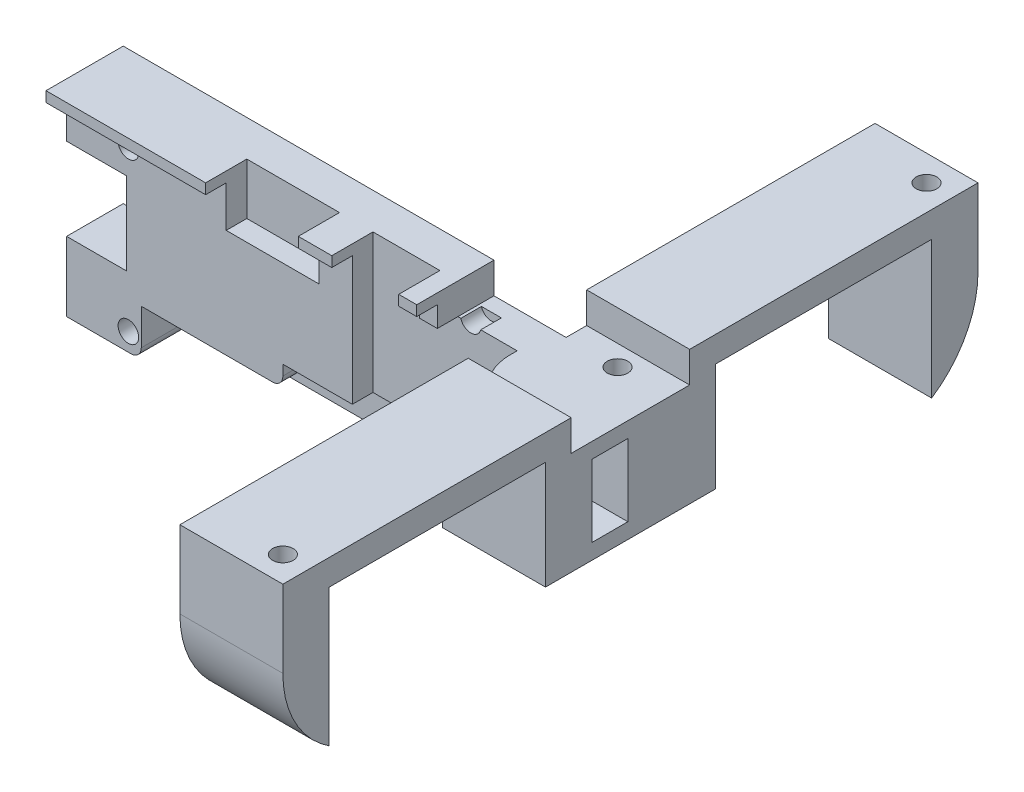
from build123d import *

# Parameters (mm, degrees)
BOSS_EXTRUDE1_DEPTH = 35
CUT_EXTRUDE1_REACH  = 164.604
SKETCH2_W           = 42
SKETCH2_H           = 21
SKETCH3_R           = 2
CUT_EXTRUDE2_DEPTH  = 10
FILLET1_R           = 20
CUT_EXTRUDE5_REACH  = 164.604
SKETCH6_W           = 42
SKETCH6_H           = 9
SKETCH7_R           = 2
CUT_EXTRUDE6_DEPTH  = 12
CUT_EXTRUDE7_DEPTH  = 9
SKETCH9_R           = 2
CUT_EXTRUDE8_DEPTH  = 10
CUT_EXTRUDE9_DEPTH  = 6
SKETCH11_R          = 2
CUT_EXTRUDE10_DEPTH = 9
SKETCH12_R          = 2
CUT_EXTRUDE11_DEPTH = 10
SKETCH14_W          = 83
SKETCH14_H          = 33
CUT_EXTRUDE13_DEPTH = 4
CUT_EXTRUDE14_DEPTH = 6.5
SKETCH16_W          = 14.5
SKETCH16_H          = 11
BOSS_EXTRUDE2_DEPTH = 5
SKETCH13_R          = 2
CUT_EXTRUDE12_DEPTH = 12
FILLET2_R           = 2
FILLET3_R           = 2
SKETCH17_W          = 18
SKETCH17_H          = 10
CUT_EXTRUDE15_DEPTH = 8
CUT_EXTRUDE18_REACH = 104.86
SKETCH20_W          = 8
SKETCH20_H          = 16
CHAMFER1_SIZE       = 10
CHAMFER1_SIZE2      = 3.639702343
CUT_EXTRUDE19_REACH = 164.604
SKETCH22_W          = 7
SKETCH22_H          = 14
FILLET8_R           = 10


with BuildPart() as part:
    # Sketch1 → Boss-Extrude1 (new body)
    with BuildSketch(Plane(origin=(0, 0, 0), x_dir=(1, 0, 0), z_dir=(0, 1, 0))):
        Polygon((-40.317617866, 43.23325062), (45.682382134, 43.23325062), (45.682382134, -16.76674938), (65.682382134, -16.76674938), (65.682382134, 118.23325062), (45.682382134, 118.23325062), (45.682382134, 58.23325062), (-40.317617866, 58.23325062), align=None)
    extrude(amount=BOSS_EXTRUDE1_DEPTH)

    # Sketch2 → Cut-Extrude1 (cut, up to next)
    with BuildSketch(Plane(origin=(65.682382134, 0, 0), x_dir=(0, 0, -1), z_dir=(1, 0, 0)), mode=Mode.PRIVATE) as cut_extrude1_sk1:
        with Locations((13.23325062, 19.5)):
            Rectangle(SKETCH2_W, SKETCH2_H)
    cut_extrude1_tool1 = extrude(cut_extrude1_sk1.sketch, amount=-CUT_EXTRUDE1_REACH, mode=Mode.PRIVATE) & part.part
    # Sketch2 → Cut-Extrude1 (cut, up to next)
    with BuildSketch(Plane(origin=(65.682382134, 0, 0), x_dir=(0, 0, -1), z_dir=(1, 0, 0)), mode=Mode.PRIVATE) as cut_extrude1_sk2:
        with Locations((88.23325062, 19.5)):
            Rectangle(SKETCH2_W, SKETCH2_H)
    cut_extrude1_tool2 = extrude(cut_extrude1_sk2.sketch, amount=-CUT_EXTRUDE1_REACH, mode=Mode.PRIVATE) & part.part
    add(cut_extrude1_tool1.solids().sort_by_distance((65.682382, 19.5, -13.233251))[0], mode=Mode.SUBTRACT)
    add(cut_extrude1_tool2.solids().sort_by_distance((65.682382, 19.5, -88.233251))[0], mode=Mode.SUBTRACT)

    # Sketch3 → Cut-Extrude2 (cut)
    with BuildSketch(Plane.ZY.offset(-45.682382134)):
        with Locations((11.26674938, 24.75)):
            Circle(SKETCH3_R)
        with Locations((11.26674938, 15.25)):
            Circle(SKETCH3_R)
        with Locations((-37.73325062, 24.75)):
            Circle(SKETCH3_R)
        with Locations((-37.73325062, 15.25)):
            Circle(SKETCH3_R)
        with Locations(Location((-112.73325062, 24.75, 0), (0, 0, 180))):
            Circle(SKETCH3_R)
        with Locations(Location((-112.73325062, 15.25, 0), (0, 0, 180))):
            Circle(SKETCH3_R)
        with Locations(Location((-63.73325062, 15.25, 0), (0, 0, 180))):
            Circle(SKETCH3_R)
        with Locations(Location((-63.73325062, 24.75, 0), (0, 0, 180))):
            Circle(SKETCH3_R)
    extrude(amount=-CUT_EXTRUDE2_DEPTH, mode=Mode.SUBTRACT)

    # Fillet1
    fillet1_edges = [part.edges().sort_by_distance(p)[0] for p in [
        (55.682382134, 0, -118.23325062),
        (55.682382134, 0, 16.76674938),
    ]]
    fillet(fillet1_edges, radius=FILLET1_R)

    # Sketch6 → Cut-Extrude5 (cut, up to next)
    with BuildSketch(Plane(origin=(65.682382134, 0, 0), x_dir=(0, 0, -1), z_dir=(1, 0, 0)), mode=Mode.PRIVATE) as cut_extrude5_sk1:
        with Locations((13.23325062, 4.5)):
            Rectangle(SKETCH6_W, SKETCH6_H)
    cut_extrude5_tool1 = extrude(cut_extrude5_sk1.sketch, amount=-CUT_EXTRUDE5_REACH, mode=Mode.PRIVATE) & part.part
    # Sketch6 → Cut-Extrude5 (cut, up to next)
    with BuildSketch(Plane(origin=(65.682382134, 0, 0), x_dir=(0, 0, -1), z_dir=(1, 0, 0)), mode=Mode.PRIVATE) as cut_extrude5_sk2:
        with Locations((88.23325062, 4.5)):
            Rectangle(SKETCH6_W, SKETCH6_H)
    cut_extrude5_tool2 = extrude(cut_extrude5_sk2.sketch, amount=-CUT_EXTRUDE5_REACH, mode=Mode.PRIVATE) & part.part
    add(cut_extrude5_tool1.solids().sort_by_distance((65.682382, 4.5, -13.233251))[0], mode=Mode.SUBTRACT)
    add(cut_extrude5_tool2.solids().sort_by_distance((65.682382, 4.5, -88.233251))[0], mode=Mode.SUBTRACT)

    # Sketch7 → Cut-Extrude6 (cut)
    with BuildSketch(Plane.ZY.offset(40.317617866)):
        with Locations((-50.73325062, 28.5)):
            Circle(SKETCH7_R)
        with Locations((-50.73325062, 5)):
            Circle(SKETCH7_R)
    extrude(amount=-CUT_EXTRUDE6_DEPTH, mode=Mode.SUBTRACT)

    # Sketch8 → Cut-Extrude7 (cut)
    with BuildSketch(Plane.XZ):
        Polygon((45.682382134, -67.23325062), (45.682382134, -58.23325062), (25.682382134, -58.23325062), (25.682382134, -43.23325062), (45.682382134, -43.23325062), (45.682382134, -34.23325062), (65.682382134, -34.23325062), (65.682382134, -67.23325062), align=None)
    extrude(amount=-CUT_EXTRUDE7_DEPTH, mode=Mode.SUBTRACT)

    # Sketch9 → Cut-Extrude8 (cut)
    with BuildSketch(Plane.XZ.offset(-9)):
        with Locations(Location((55.682382134, -42.23325062, 0), (0, 0, 270))):
            Circle(SKETCH9_R)
        with Locations(Location((55.682382134, -59.23325062, 0), (0, 0, 270))):
            Circle(SKETCH9_R)
    extrude(amount=-CUT_EXTRUDE8_DEPTH, mode=Mode.SUBTRACT)

    # Sketch10 → Cut-Extrude9 (cut)
    with BuildSketch(Plane(origin=(0, 35, 0), x_dir=(1, 0, 0), z_dir=(0, 1, 0))):
        Polygon((45.682382134, 62.23325062), (65.682382134, 62.23325062), (65.682382134, 39.23325062), (45.682382134, 39.23325062), (45.682382134, 43.23325062), (31.682382134, 43.23325062), (31.682382134, 58.23325062), (45.682382134, 58.23325062), align=None)
    extrude(amount=-CUT_EXTRUDE9_DEPTH, mode=Mode.SUBTRACT)

    # Sketch11 → Cut-Extrude10 (cut)
    with BuildSketch(Plane(origin=(0, 29, 0), x_dir=(1, 0, 0), z_dir=(0, 1, 0))):
        with Locations(Location((55.682382134, 58.23325062, 0), (0, 0, 270))):
            Circle(SKETCH11_R)
        with Locations(Location((55.682382134, 43.23325062, 0), (0, 0, 270))):
            Circle(SKETCH11_R)
    extrude(amount=-CUT_EXTRUDE10_DEPTH, mode=Mode.SUBTRACT)

    # Sketch12 → Cut-Extrude11 (cut)
    with BuildSketch(Plane(origin=(0, 35, 0), x_dir=(1, 0, 0), z_dir=(0, 1, 0))):
        with Locations(Location((60.682382134, -11.76674938, 0), (0, 0, 270))):
            Circle(SKETCH12_R)
        with Locations(Location((60.682382134, 113.23325062, 0), (0, 0, 270))):
            Circle(SKETCH12_R)
    extrude(amount=-CUT_EXTRUDE11_DEPTH, mode=Mode.SUBTRACT)

    # Sketch14 → Cut-Extrude13 (cut)
    with BuildSketch(Plane.XY.offset(-43.23325062)):
        with Locations((1.182382134, 16.5)):
            Rectangle(SKETCH14_W, SKETCH14_H)
    extrude(amount=-CUT_EXTRUDE13_DEPTH, mode=Mode.SUBTRACT)

    # Sketch15 → Cut-Extrude14 (cut)
    with BuildSketch(Plane.XY.offset(-47.23325062)):
        Polygon((1.682382134, 8), (33.682382134, 8), (33.682382134, 0), (-25.817617866, 0), (-25.817617866, 4), (1.682382134, 4), align=None)
    extrude(amount=-CUT_EXTRUDE14_DEPTH, mode=Mode.SUBTRACT)

    # Sketch16 → Boss-Extrude2 (add)
    with BuildSketch(Plane.XZ):
        with Locations((-33.067617866, -52.73325062)):
            Rectangle(SKETCH16_W, SKETCH16_H)
    extrude(amount=BOSS_EXTRUDE2_DEPTH)

    # Sketch13 → Cut-Extrude12 (cut)
    with BuildSketch(Plane.XY.offset(-43.23325062)):
        with Locations((-28.317617866, 29.5)):
            Circle(SKETCH13_R)
        with Locations((34.182382134, 29.5)):
            Circle(SKETCH13_R)
        with Locations((34.182382134, -1.5)):
            Circle(SKETCH13_R)
        with Locations((-28.317617866, -1.5)):
            Circle(SKETCH13_R)
    extrude(amount=-CUT_EXTRUDE12_DEPTH, mode=Mode.SUBTRACT)

    # Fillet2
    fillet2_edges = [part.edges().sort_by_distance(p)[0] for p in [
        (-25.817617866, -5, -52.73325062),
    ]]
    fillet(fillet2_edges, radius=FILLET2_R)

    # Fillet3
    fillet3_edges = [part.edges().sort_by_distance(p)[0] for p in [
        (1.682382134, 4, -50.48325062),
    ]]
    fillet(fillet3_edges, radius=FILLET3_R)

    # Sketch17 → Cut-Extrude15 (cut)
    with BuildSketch(Plane.XY.offset(-43.23325062)):
        Polygon((43.182382134, -5), (15.182382134, -5), (15.182382134, 35), (28.182382134, 35), (28.182382134, 29), (43.182382134, 29), align=None)
        with Locations((-0.317617866, 30)):
            Rectangle(SKETCH17_W, SKETCH17_H)
    extrude(amount=-CUT_EXTRUDE15_DEPTH, mode=Mode.SUBTRACT)

    # Sketch20 → Cut-Extrude18 (cut, up to next)
    with BuildSketch(Plane.XY.offset(-47.23325062), mode=Mode.PRIVATE) as cut_extrude18_sk1:
        with Locations((-36.317617866, 16.5)):
            Rectangle(SKETCH20_W, SKETCH20_H)
    cut_extrude18_tool1 = extrude(cut_extrude18_sk1.sketch, amount=-CUT_EXTRUDE18_REACH, mode=Mode.PRIVATE) & part.part
    add(cut_extrude18_tool1.solids().sort_by_distance((-36.317618, 16.5, -47.233251))[0], mode=Mode.SUBTRACT)

    # Chamfer1
    chamfer1_edges = [part.edges().sort_by_distance(p)[0] for p in [
        (-32.317617866, 16.5, -47.23325062),
    ]]
    chamfer1_side = [part.faces().sort_by_distance(p)[0] for p in [
        (-32.317617866, 16.5, -52.73325062),
    ]]
    chamfer(chamfer1_edges, length=CHAMFER1_SIZE, length2=CHAMFER1_SIZE2, reference=chamfer1_side[0])

    # Sketch22 → Cut-Extrude19 (cut, up to next)
    with BuildSketch(Plane(origin=(65.682382134, 0, 0), x_dir=(0, 0, -1), z_dir=(1, 0, 0)), mode=Mode.PRIVATE) as cut_extrude19_sk1:
        with Locations((46.73325062, 19)):
            Rectangle(SKETCH22_W, SKETCH22_H)
    cut_extrude19_tool1 = extrude(cut_extrude19_sk1.sketch, amount=-CUT_EXTRUDE19_REACH, mode=Mode.PRIVATE) & part.part
    add(cut_extrude19_tool1.solids().sort_by_distance((65.682382, 19, -46.733251))[0], mode=Mode.SUBTRACT)

    # Fillet8
    # the kernel refuses this fillet: 10 mm, written as the material it takes off along each edge
    with BuildSketch(Plane(origin=(43.182382134, 28.535945694, -43.23325062), x_dir=(0, 0, -1), z_dir=(0, -1, 0)), Plane(origin=(43.182382134, 45.535945694, -43.23325062), x_dir=(0, 0, -1), z_dir=(0, -1, 0))) as fillet8_piece_1:
        with BuildLine():
            CenterArc((6.614378278, 10), FILLET8_R, 228.590377891, 41.409622109)
            Line((0, 2.5), (0, 0))
            Line((0, 0), (6.614378278, 0))
        make_face()
    extrude(amount=36.071891388, mode=Mode.SUBTRACT)


solid = part.part
